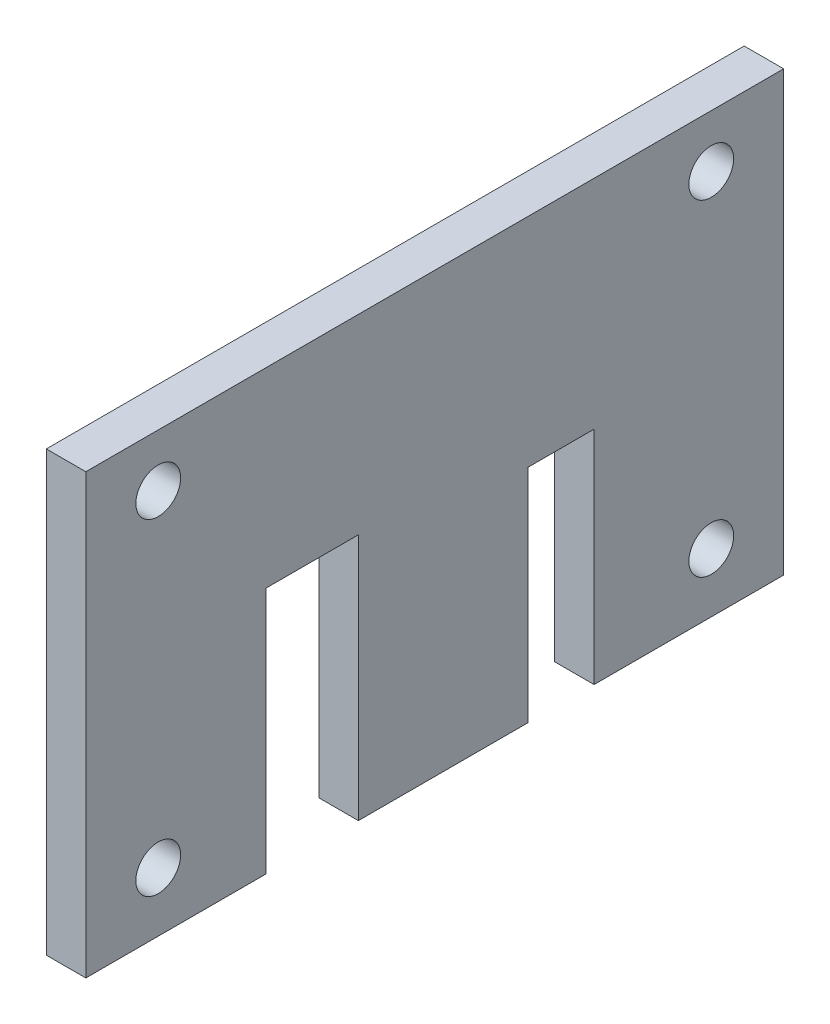
from build123d import *

# Parameters (mm, degrees)
SKETCH1_W           = 53
SKETCH1_H           = 33.3
COVER_PLATE_DEPTH   = 3
SKETCH2_W           = 7
SKETCH2_H           = 19.8
SKETCH2_W_2         = 5
SKETCH2_H_2         = 17.8
CABLE_NOTCHES_DEPTH = 5
SKETCH3_R           = 1.7
SCREW_HOLES_DEPTH   = 5


with BuildPart() as part:
    # Sketch1 → Cover Plate (new body)
    with BuildSketch(Plane(origin=(72.4, 0, 0), x_dir=(0, 0, -1), z_dir=(1, 0, 0))):
        with Locations((-73, -10.15)):
            Rectangle(SKETCH1_W, SKETCH1_H)
    extrude(amount=COVER_PLATE_DEPTH)

    # Sketch2 → Cable Notches (cut)
    with BuildSketch(Plane(origin=(71.4, 0, 0), x_dir=(0, 0, -1), z_dir=(1, 0, 0))):
        with Locations((-82.3, -17.9)):
            Rectangle(SKETCH2_W, SKETCH2_H)
        with Locations((-63.4, -18.9)):
            Rectangle(SKETCH2_W_2, SKETCH2_H_2)
    extrude(amount=CABLE_NOTCHES_DEPTH, mode=Mode.SUBTRACT)

    # Sketch3 → Screw Holes (cut)
    with BuildSketch(Plane(origin=(71.4, 0, 0), x_dir=(0, 0, -1), z_dir=(1, 0, 0))):
        with Locations((-94, -22.3)):
            Circle(SKETCH3_R)
        with Locations((-94, 2.5)):
            Circle(SKETCH3_R)
        with Locations((-52, -22.3)):
            Circle(SKETCH3_R)
        with Locations((-52, 2.5)):
            Circle(SKETCH3_R)
    extrude(amount=SCREW_HOLES_DEPTH, mode=Mode.SUBTRACT)


solid = part.part
